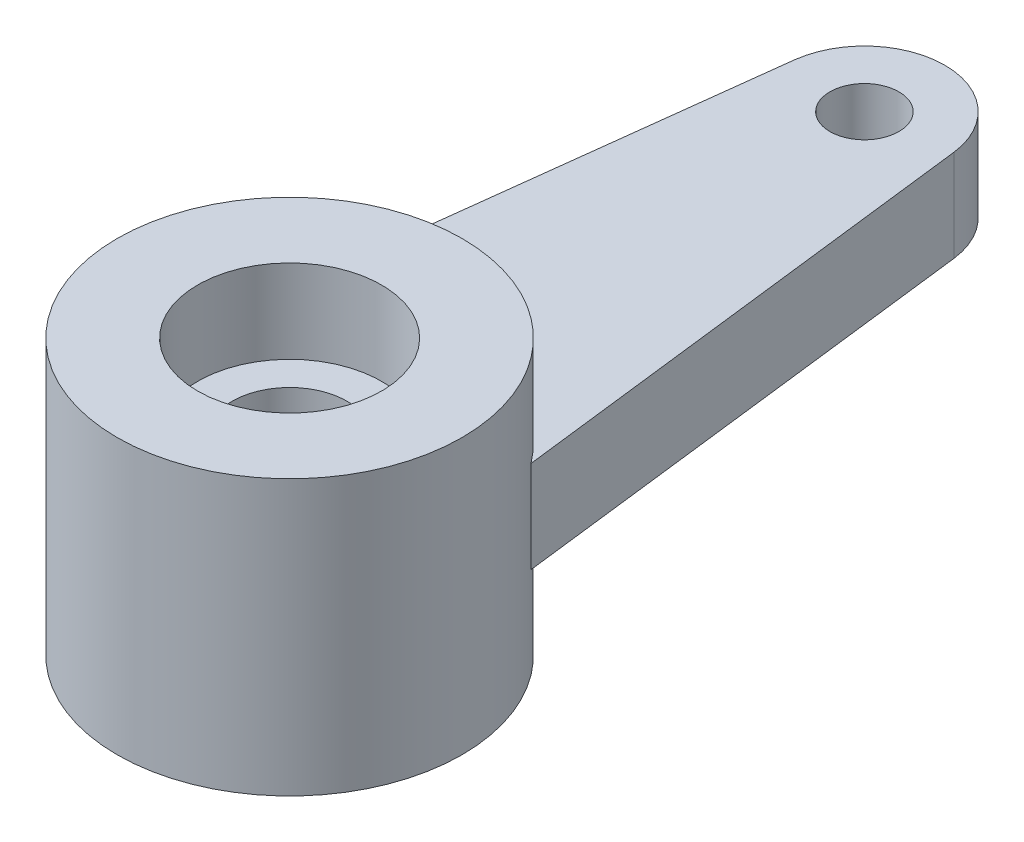
from build123d import *

# Parameters (mm, degrees)
SKETCH1_R                = 7.5
BOSS_EXTRUDE1_DEPTH      = 5.975
ROD_CUTOUT_DEPTH         = 16.978188258
ROD_CUTOUT_DEPTH_BACK    = 16.978188258
SKETCH2_R                = 2.5
SKETCH3_R                = 4
BEARING_CUTOUT_DEPTH     = 3.63
STEERINGLINK_MOUNT_DEPTH = 2
SKETCH5_R                = 2.5
CUT_EXTRUDE3_DEPTH       = 32.800982689
SKETCH6_R                = 1.5
LINKAGEMOUNT_HOLE_DEPTH  = 10


with BuildPart() as part:
    # Sketch1 → Boss-Extrude1 (new, symmetric)
    with BuildSketch(Plane(origin=(0, 0, 0), x_dir=(1, 0, 0), z_dir=(0, 1, 0))):
        Circle(SKETCH1_R)
    extrude(amount=BOSS_EXTRUDE1_DEPTH, both=True)

    # Sketch2 → Rod-Cutout (cut, two sides: drawn at the far end of the back side and taken through both)
    with BuildSketch(Plane(origin=(0, 5.975, 0), x_dir=(1, 0, 0), z_dir=(0, 1, 0)).offset(-ROD_CUTOUT_DEPTH_BACK)):
        Circle(SKETCH2_R)
    extrude(amount=ROD_CUTOUT_DEPTH + ROD_CUTOUT_DEPTH_BACK, mode=Mode.SUBTRACT)

    # Sketch3 → Bearing-Cutout (cut)
    with BuildSketch(Plane(origin=(0, 5.975, 0), x_dir=(1, 0, 0), z_dir=(0, 1, 0))):
        Circle(SKETCH3_R)
    bearing_cutout = extrude(amount=-BEARING_CUTOUT_DEPTH, mode=Mode.SUBTRACT)

    # Mirror1: Bearing-Cutout across plane
    add(bearing_cutout.mirror(Plane.ZX), mode=Mode.SUBTRACT)

    # Sketch4 → SteeringLink-Mount (add, symmetric)
    with BuildSketch(Plane(origin=(0, 0, 0), x_dir=(1, 0, 0), z_dir=(0, 1, 0))):
        with BuildLine():
            Line((-6, 0), (6, 0))
            Line((6, 0), (6, 4.5))
            Line((6, 4.5), (3.474775482, 25.419446482))
            ThreePointArc((3.474775482, 25.419446482), (0, 28.5), (-3.474775482, 25.419446482))
            Line((-3.474775482, 25.419446482), (-6, 4.5))
            Line((-6, 4.5), (-6, 0))
        make_face()
    extrude(amount=STEERINGLINK_MOUNT_DEPTH, both=True)

    # Sketch5 → Cut-Extrude3 (cut, through all)
    with BuildSketch(Plane(origin=(0, 5.975, 0), x_dir=(1, 0, 0), z_dir=(0, 1, 0))):
        Circle(SKETCH5_R)
    extrude(amount=-CUT_EXTRUDE3_DEPTH, mode=Mode.SUBTRACT)

    # Sketch6 → LinkageMount-Hole (cut)
    with BuildSketch(Plane(origin=(0, 2, 0), x_dir=(1, 0, 0), z_dir=(0, 1, 0))):
        with Locations((0, 25)):
            Circle(SKETCH6_R)
    extrude(amount=-LINKAGEMOUNT_HOLE_DEPTH, mode=Mode.SUBTRACT)


solid = part.part
